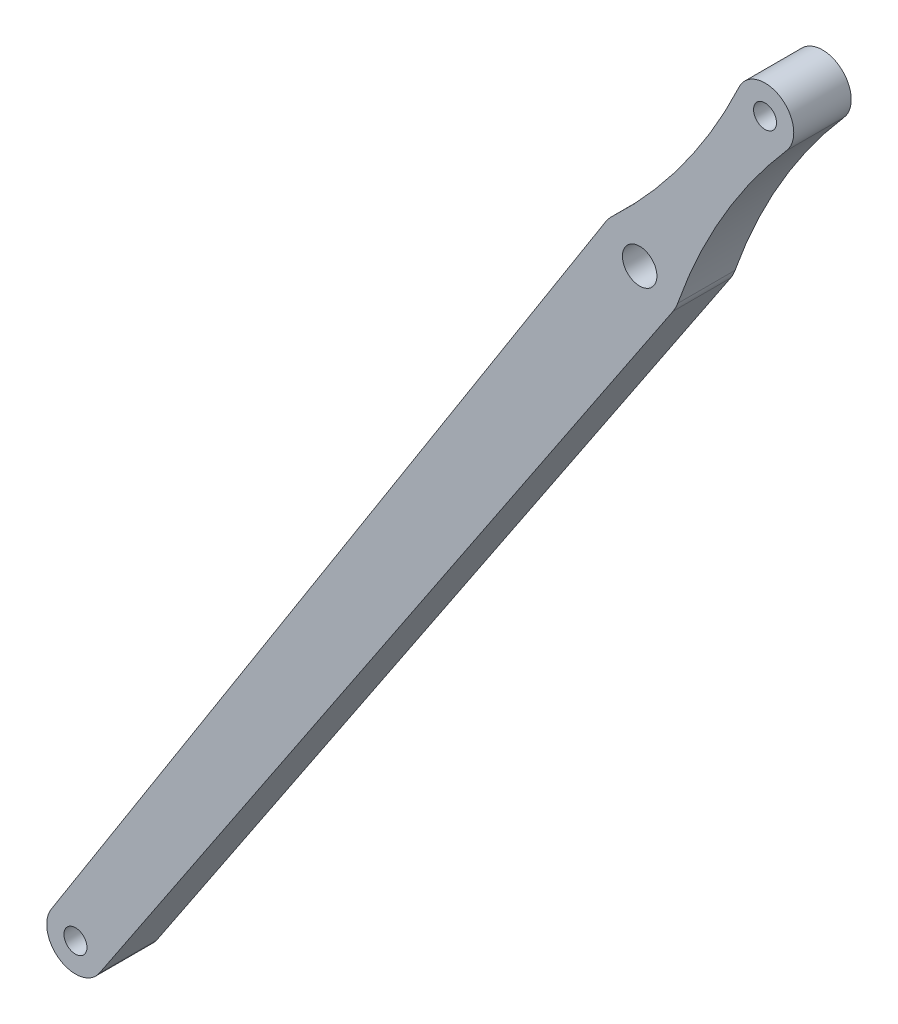
from build123d import *

# Parameters (mm, degrees)
BOSS_EXTRUDE1_DEPTH      = 5
BOSS_EXTRUDE1_DEPTH_BACK = 5
SKETCH1_R                = 3
SKETCH1_R_2              = 2


with BuildPart() as part:
    # Sketch1 → Boss-Extrude1 (new, two sides: drawn at the far end of the back side and taken through both)
    with BuildSketch(Plane.XY.offset(-BOSS_EXTRUDE1_DEPTH_BACK)):
        with BuildLine():
            Line((-239.811661053, -45.910021856), (-139.929423137, 103.821533099))
            ThreePointArc((-139.929423137, 103.821533099), (-139.490833746, 104.577292215), (-139.14981824, 105.381805062))
            ThreePointArc((-139.14981824, 105.381805062), (-131.202379466, 122.562863878), (-120.159540529, 137.938372757))
            ThreePointArc((-120.159540529, 137.938372757), (-121.198063596, 145.416438673), (-128.457088576, 143.341214268))
            ThreePointArc((-128.457088576, 143.341214268), (-138.051487579, 127.022572386), (-150.549253409, 112.804400409))
            ThreePointArc((-150.549253409, 112.804400409), (-151.14706006, 112.167093808), (-151.66080983, 111.460274404))
            Line((-151.66080983, 111.460274404), (-248.191222976, -40.453778066))
            ThreePointArc((-248.191222976, -40.453778066), (-246.69941799, -47.325383579), (-239.811661053, -45.910021856))
        make_face()
        with Locations((-145.752676412, 107.706082145)):
            Circle(SKETCH1_R, mode=Mode.SUBTRACT)
        with Locations((-243.971127678, -43.135343965)):
            Circle(SKETCH1_R_2, mode=Mode.SUBTRACT)
        with Locations((-123.926353909, 141.226399059)):
            Circle(SKETCH1_R_2, mode=Mode.SUBTRACT)
    extrude(amount=BOSS_EXTRUDE1_DEPTH + BOSS_EXTRUDE1_DEPTH_BACK)


solid = part.part
